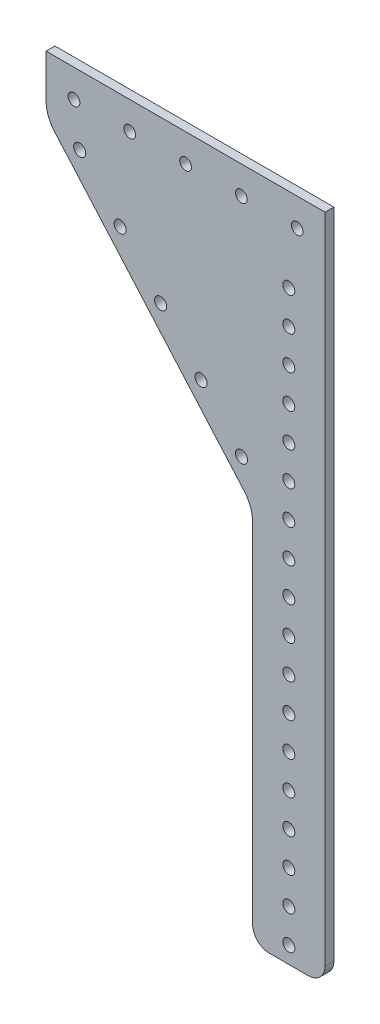
from build123d import *

# Parameters (mm, degrees)
SKETCH1_R           = 2.15
SKETCH1_R_2         = 2.1
BOSS_EXTRUDE1_DEPTH = 3.175
FILLET2_R           = 12
FILLET3_R           = 6


with BuildPart() as part:
    # Sketch1 → Boss-Extrude1 (new body)
    with BuildSketch(Plane.XY):
        Polygon((26, 240), (26, 0), (0, 0), (0, 135.544479344), (-74, 220), (-74, 240), align=None)
        with Locations((13, 6)):
            Circle(SKETCH1_R, mode=Mode.SUBTRACT)
        with Locations((13, 18)):
            Circle(SKETCH1_R, mode=Mode.SUBTRACT)
        with Locations((13, 30)):
            Circle(SKETCH1_R, mode=Mode.SUBTRACT)
        with Locations((13, 42)):
            Circle(SKETCH1_R, mode=Mode.SUBTRACT)
        with Locations((13, 54)):
            Circle(SKETCH1_R, mode=Mode.SUBTRACT)
        with Locations((13, 66)):
            Circle(SKETCH1_R, mode=Mode.SUBTRACT)
        with Locations((13, 78)):
            Circle(SKETCH1_R, mode=Mode.SUBTRACT)
        with Locations((13, 90)):
            Circle(SKETCH1_R, mode=Mode.SUBTRACT)
        with Locations((13, 102)):
            Circle(SKETCH1_R, mode=Mode.SUBTRACT)
        with Locations((13, 114)):
            Circle(SKETCH1_R, mode=Mode.SUBTRACT)
        with Locations((13, 126)):
            Circle(SKETCH1_R, mode=Mode.SUBTRACT)
        with Locations((13, 138)):
            Circle(SKETCH1_R, mode=Mode.SUBTRACT)
        with Locations((13, 150)):
            Circle(SKETCH1_R, mode=Mode.SUBTRACT)
        with Locations((13, 162)):
            Circle(SKETCH1_R, mode=Mode.SUBTRACT)
        with Locations((13, 174)):
            Circle(SKETCH1_R, mode=Mode.SUBTRACT)
        with Locations((13, 186)):
            Circle(SKETCH1_R, mode=Mode.SUBTRACT)
        with Locations((13, 198)):
            Circle(SKETCH1_R, mode=Mode.SUBTRACT)
        with Locations((13, 210)):
            Circle(SKETCH1_R, mode=Mode.SUBTRACT)
        with Locations((16, 230)):
            Circle(SKETCH1_R_2, mode=Mode.SUBTRACT)
        with Locations((-4, 230)):
            Circle(SKETCH1_R_2, mode=Mode.SUBTRACT)
        with Locations((-24, 230)):
            Circle(SKETCH1_R_2, mode=Mode.SUBTRACT)
        with Locations((-44, 230)):
            Circle(SKETCH1_R_2, mode=Mode.SUBTRACT)
        with Locations((-64, 230)):
            Circle(SKETCH1_R_2, mode=Mode.SUBTRACT)
        with Locations((-3.954096026, 149.161735826)):
            Circle(SKETCH1_R, mode=Mode.SUBTRACT)
        with Locations((-18.452448122, 165.708571974)):
            Circle(SKETCH1_R, mode=Mode.SUBTRACT)
        with Locations((-32.950800218, 182.255408122)):
            Circle(SKETCH1_R, mode=Mode.SUBTRACT)
        with Locations((-47.449152315, 198.802244269)):
            Circle(SKETCH1_R, mode=Mode.SUBTRACT)
        with Locations((-61.947504411, 215.349080417)):
            Circle(SKETCH1_R, mode=Mode.SUBTRACT)
    extrude(amount=BOSS_EXTRUDE1_DEPTH)

    # Fillet2
    fillet2_edges = [part.edges().sort_by_distance(p)[0] for p in [
        (0, 135.544479344, 1.5875),
        (-74, 220, 1.5875),
    ]]
    fillet(fillet2_edges, radius=FILLET2_R)

    # Fillet3
    fillet3_edges = [part.edges().sort_by_distance(p)[0] for p in [
        (26, 0, 1.5875),
        (0, 0, 1.5875),
    ]]
    fillet(fillet3_edges, radius=FILLET3_R)


solid = part.part
